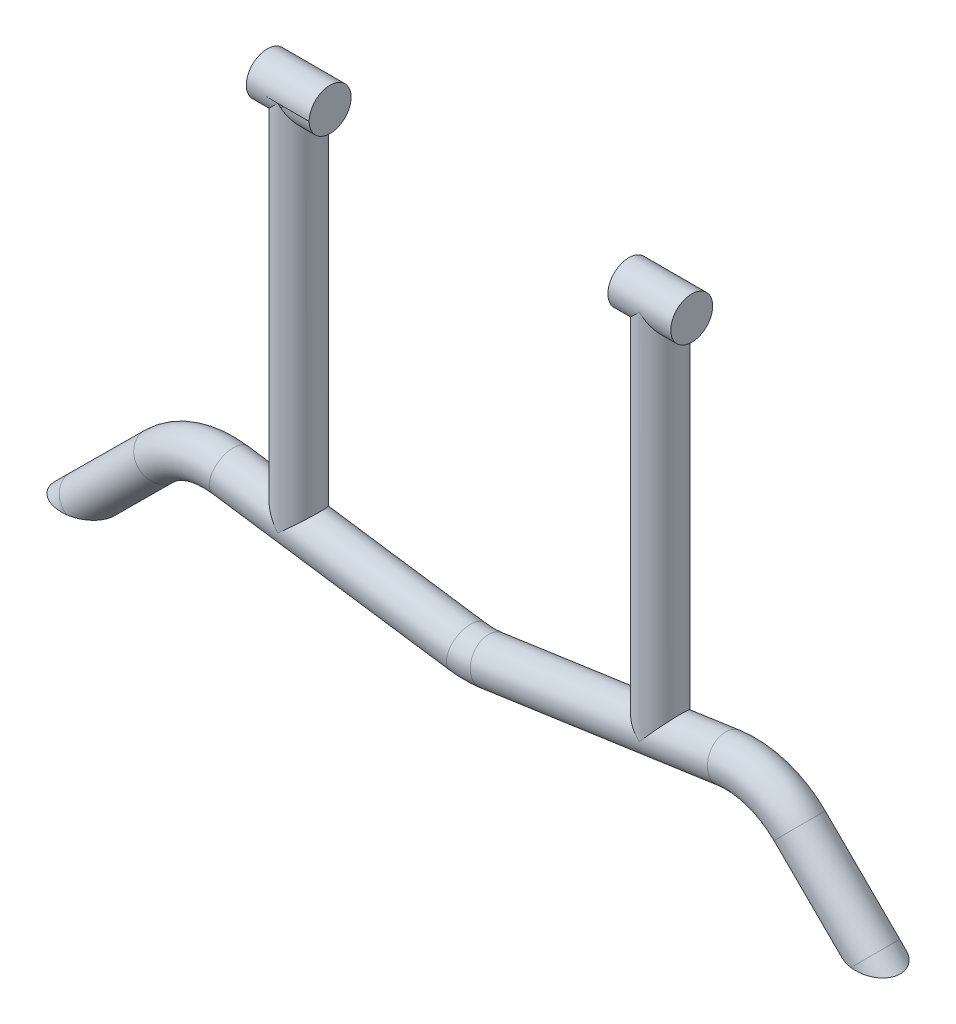
from build123d import *

# Parameters (mm, degrees)
SWEEP1_PROFILE_R     = 12.7
SWEEP2_PROFILE_R     = 12.7
SWEEP3_PROFILE_R     = 12.7
CUT_SWEEP1_START     = -81.549620248
CUT_SWEEP1_OUTLINE_W = 67
CUT_SWEEP1_OUTLINE_H = 33
CUT_SWEEP1_DEPTH     = 44.599672867


# Read off the part's stored shape, not the designer's step: Cut-Sweep1
with BuildPart() as part:
    # Sweep1: sweep along a path in Sketch1
    with BuildLine(Plane.XY) as sweep1_path:
        Line((275.126088043, -73.014540772), (239.071642227, -37.227435037))
        Line((239.071642227, -37.227435037), (193.952445621, 7.557207275))
        ThreePointArc((193.952445621, 7.557207275), (174.105035635, 19.737252225), (150.908197029, 21.781722044))
        Line((150.908197029, 21.781722044), (7.257142857, 1.047478346))
        ThreePointArc((7.257142857, 1.047478346), (0, 0.526438931), (-7.257142857, 1.047478346))
        Line((-7.257142857, 1.047478346), (-150.908197029, 21.781722044))
        ThreePointArc((-150.908197029, 21.781722044), (-174.105035635, 19.737252225), (-193.952445621, 7.557207275))
        Line((-193.952445621, 7.557207275), (-239.071642227, -37.227435037))
        Line((-239.071642227, -37.227435037), (-275.126088043, -73.014540772))
    # Sweep1 profile (on start of the path) → Sweep1 (sweep)
    with BuildSketch(Plane(origin=(275.126088043, -73.014540772, 0), x_dir=(-0.7044705853386212, -0.7097331853539472, 0), z_dir=(-0.7097331853539472, 0.7044705853386212, 0))):
        Circle(SWEEP1_PROFILE_R)
    sweep(path=sweep1_path.line)

    # Sweep2: sweep along a path in Sketch1<3>
    with BuildLine(Plane.XY) as sweep2_path:
        Line((109.5375, 15.810376278), (109.5375, 241.235376278))
    # Sweep2 profile (on start of the path) → Sweep2 (sweep)
    with BuildSketch(Plane(origin=(109.5375, 15.810376278, 0), x_dir=(0, 0, 1), z_dir=(0, 1, 0))):
        Circle(SWEEP2_PROFILE_R)
    sweep2 = sweep(path=sweep2_path.line)

    # Sweep3: sweep along a path in Sketch1<4>
    with BuildLine(Plane.XY) as sweep3_path:
        Line((128.5875, 241.235376278), (90.4875, 241.235376278))
    # Sweep3 profile (on start of the path) → Sweep3 (sweep)
    with BuildSketch(Plane(origin=(128.5875, 241.235376278, 0), x_dir=(0, -1, 0), z_dir=(-1, 0, 0))):
        Circle(SWEEP3_PROFILE_R)
    sweep3 = sweep(path=sweep3_path.line)

    # Cut-Sweep1 outline → Cut-Sweep1 (cut)
    with BuildSketch(Plane(origin=(0, 0, 0), x_dir=(1, 0, 0), z_dir=(0, 0.992546151641322, 0.121869343405149)).offset(CUT_SWEEP1_START)):
        with Locations((252.5, -6.5)):
            Rectangle(CUT_SWEEP1_OUTLINE_W, CUT_SWEEP1_OUTLINE_H)
    cut_sweep1 = extrude(amount=CUT_SWEEP1_DEPTH, mode=Mode.SUBTRACT)

    # Mirror2: Sweep2, Sweep3, Cut-Sweep1 across plane
    add(sweep2.mirror(Plane(origin=(0, 0, 0), x_dir=(0, 0, 1), z_dir=(1, 0, 0))))
    add(sweep3.mirror(Plane(origin=(0, 0, 0), x_dir=(0, 0, 1), z_dir=(1, 0, 0))))
    add(cut_sweep1.mirror(Plane(origin=(0, 0, 0), x_dir=(0, 0, 1), z_dir=(1, 0, 0))), mode=Mode.SUBTRACT)


solid = part.part
